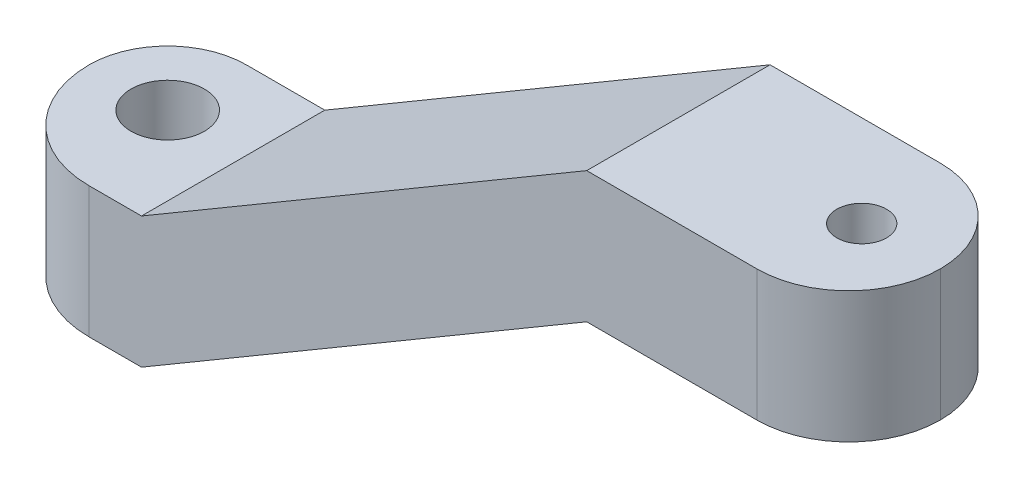
from build123d import *

# Parameters (mm, degrees)
BOSS_EXTRU_1_DEPTH      = 7
ESQUISSE3_R             = 1.4
ENL_V_MAT_EXTRU_1_DEPTH = 7
ESQUISSE4_R             = 0.95
ENL_V_MAT_EXTRU_2_DEPTH = 7
CONG_1_R                = 3.5
CONG_2_R                = 4
CONG_3_R                = 3


with BuildPart() as part:
    # Esquisse1 → Boss.-Extru.1 (new body)
    with BuildSketch(Plane.XY):
        Polygon((17, 15), (0, 5), (-6, 5), (-6, 0), (0, 0), (17, 10), (27, 10), (27, 15), align=None)
    extrude(amount=BOSS_EXTRU_1_DEPTH)

    # Esquisse3 → Enlèv. mat.-Extru.1 (cut)
    with BuildSketch(Plane(origin=(0, 5, 0), x_dir=(1, 0, 0), z_dir=(0, 1, 0))):
        with Locations(Location((-3, -3, 0), (0, 0, 270))):
            Circle(ESQUISSE3_R)
    extrude(amount=-ENL_V_MAT_EXTRU_1_DEPTH, mode=Mode.SUBTRACT)

    # Esquisse4 → Enlèv. mat.-Extru.2 (cut)
    with BuildSketch(Plane(origin=(0, 15, 0), x_dir=(1, 0, 0), z_dir=(0, 1, 0))):
        with Locations(Location((24, -3.5, 0), (0, 0, 180))):
            Circle(ESQUISSE4_R)
    extrude(amount=-ENL_V_MAT_EXTRU_2_DEPTH, mode=Mode.SUBTRACT)

    # Congé1
    cong_1_edges = [part.edges().sort_by_distance(p)[0] for p in [
        (27, 12.5, 7),
        (27, 12.5, 0),
    ]]
    fillet(cong_1_edges, radius=CONG_1_R - 0.0001)  # a hair under: the kernel refuses the full size

    # Congé2
    cong_2_edges = [part.edges().sort_by_distance(p)[0] for p in [
        (-6, 2.5, 7),
    ]]
    fillet(cong_2_edges, radius=CONG_2_R)

    # Congé3
    cong_3_edges = [part.edges().sort_by_distance(p)[0] for p in [
        (-6, 2.5, 0),
    ]]
    fillet(cong_3_edges, radius=CONG_3_R - 0.0001)  # a hair under: the kernel refuses the full size


solid = part.part
